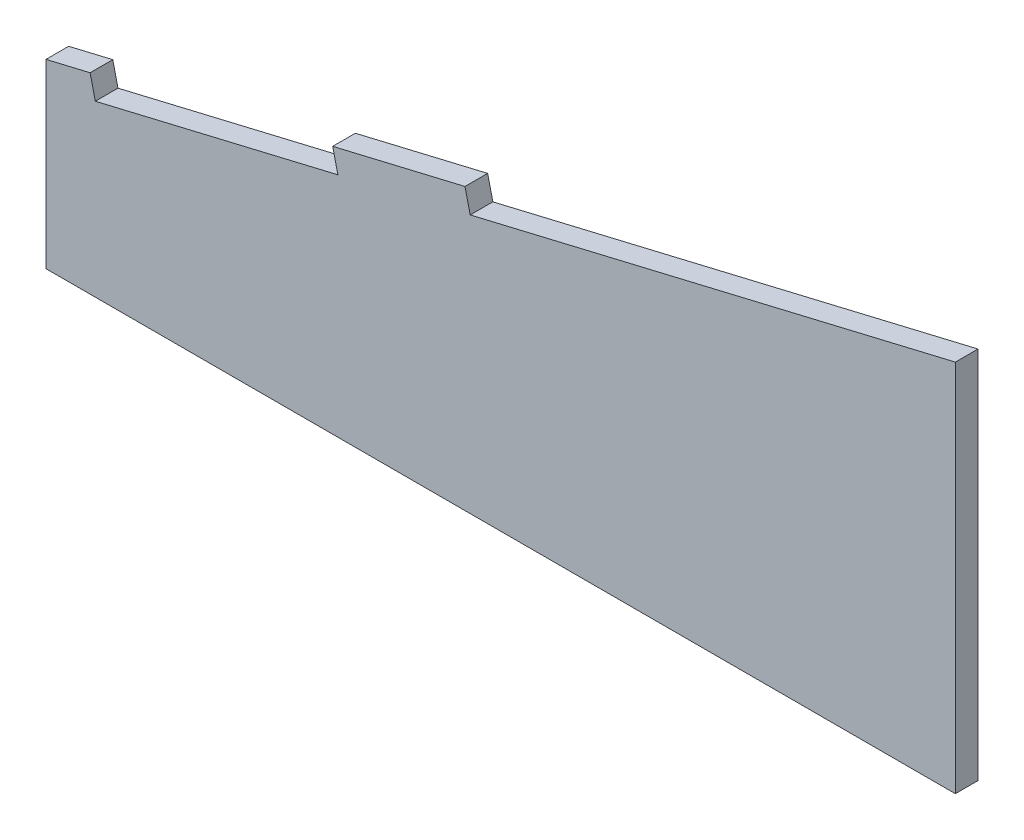
from build123d import *

# Parameters (mm, degrees)
BOSS_EXTRUDE1_DEPTH = 6.35


with BuildPart() as part:
    # Sketch1 → Boss-Extrude1 (new body)
    with BuildSketch(Plane.XY):
        Polygon((-1899.084941277, -131.16352622), (-1911.44175865, -134.095942355), (-1911.44175865, -184.895942355), (-1656.660794418, -184.895942355), (-1656.660794418, -80.159820276), (-1712.266472601, -93.355692883), (-1792.585785531, -112.41639776), (-1794.051993599, -106.237989073), (-1831.12244572, -115.035237478), (-1829.656237653, -121.213646165), (-1897.618733209, -137.341934907), align=None)
    extrude(amount=BOSS_EXTRUDE1_DEPTH)


solid = part.part
